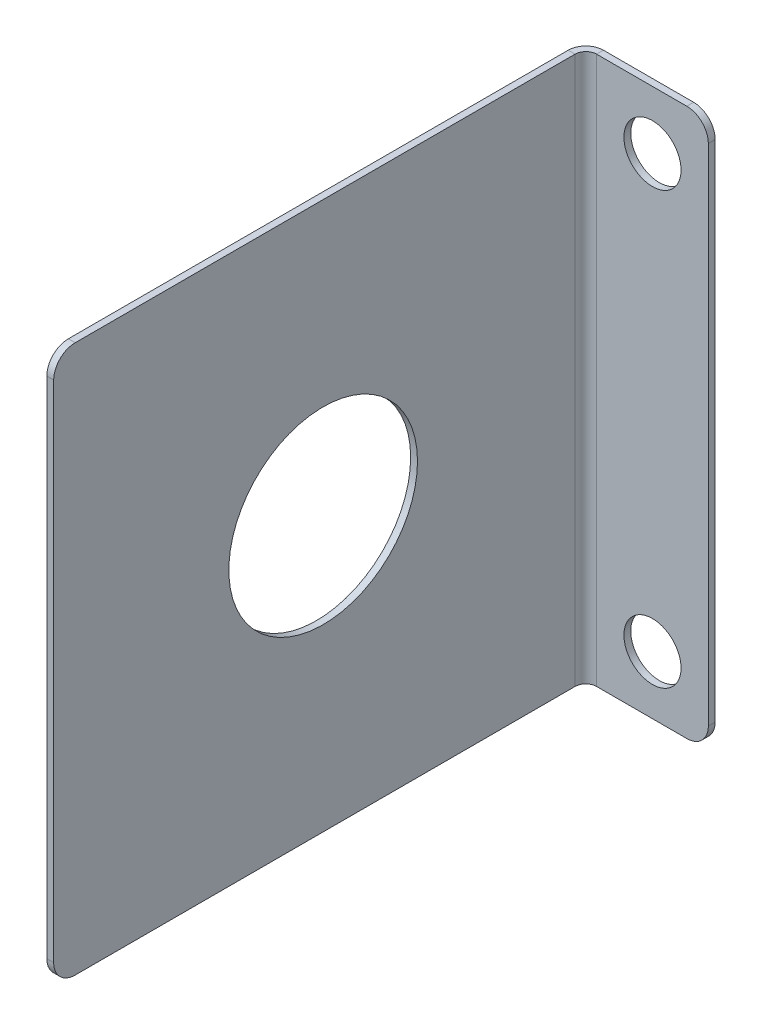
from build123d import *

# Parameters (mm, degrees)
SKETCH1_W                    = 50
SKETCH1_H                    = 50.8
BASE_FLANGE1_DEPTH           = 0.635
SKETCH9_R                    = 8.75
CUT_EXTRUDE1_DEPTH           = 36.644960724
EDGE_FLANGE1_STRIP_W         = 4.54
EDGE_FLANGE1_STRIP_H         = 0.635
EDGE_FLANGE1_STRIP_CUT_DEPTH = 50.8
EDGE_FLANGE1_DEPTH           = 50.8
SKETCH13_R                   = 2.65
CUT_EXTRUDE2_DEPTH           = 57.667684354
FILLET1_R                    = 2


# Sheet-metal steps are written as plain solids
with BuildPart() as part:
    # Sketch1 → Base-Flange1 (new body)
    with BuildSketch(Plane(origin=(0, 0, 0), x_dir=(0, 0, -1), z_dir=(1, 0, 0))):
        Rectangle(SKETCH1_W, SKETCH1_H)
    extrude(amount=-BASE_FLANGE1_DEPTH)

    # Sketch9 → Cut-Extrude1 (cut, through all)
    with BuildSketch(Plane(origin=(0, 0, 0), x_dir=(0, 0, -1), z_dir=(1, 0, 0))):
        Circle(SKETCH9_R)
    extrude(amount=-CUT_EXTRUDE1_DEPTH, mode=Mode.SUBTRACT)

    # Edge-Flange1 strip (across the edge) → Edge-Flange1 strip cut (cut)
    with BuildSketch(Plane(origin=(0, -25.4, -25), x_dir=(0, 0, 1), z_dir=(0, 1, 0))):
        with Locations((-0.635, -0.3175)):
            Rectangle(EDGE_FLANGE1_STRIP_W, EDGE_FLANGE1_STRIP_H)
    extrude(amount=EDGE_FLANGE1_STRIP_CUT_DEPTH, mode=Mode.SUBTRACT)

    # Edge-Flange1 section (across the edge) → Edge-Flange1 (add)
    with BuildSketch(Plane(origin=(0, -25.4, -25), x_dir=(0, 0, 1), z_dir=(0, 1, 0))):
        with BuildLine():
            Line((0, 1), (0, 11.365))
            Line((0, 11.365), (0.635, 11.365))
            Line((0.635, 11.365), (0.635, 1))
            ThreePointArc((0.635, 1), (0.927893219, 0.292893219), (1.635, 0))
            Line((1.635, 0), (1.635, -0.635))
            ThreePointArc((1.635, -0.635), (0.478880413, -0.156119587), (0, 1))
        make_face()
    extrude(amount=EDGE_FLANGE1_DEPTH)

    # Sketch13 → Cut-Extrude2 (cut, through all)
    with BuildSketch(Plane.XY.offset(-24.365)):
        with Locations((6.1825, -20)):
            Circle(SKETCH13_R)
        with Locations((6.1825, 20)):
            Circle(SKETCH13_R)
    extrude(amount=-CUT_EXTRUDE2_DEPTH, mode=Mode.SUBTRACT)

    # Fillet1
    fillet1_edges = [part.edges().sort_by_distance(p)[0] for p in [
        (11.365, -25.4, -24.6825),
        (11.365, 25.4, -24.6825),
        (-0.3175, -25.4, 25),
        (-0.3175, 25.4, 25),
    ]]
    fillet(fillet1_edges, radius=FILLET1_R)


solid = part.part
